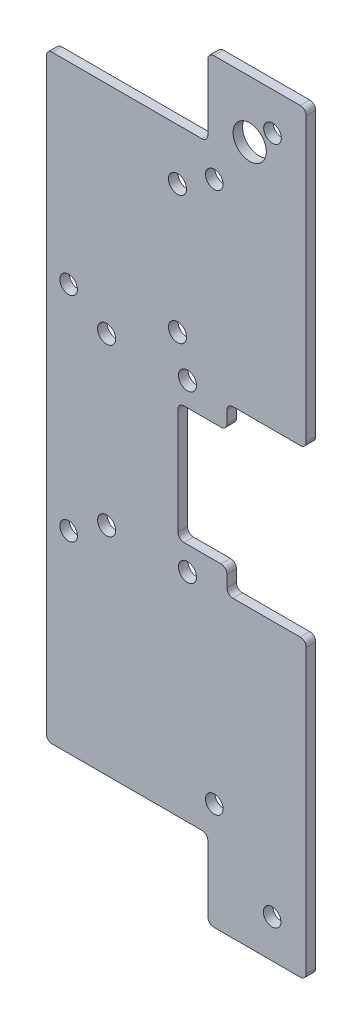
from build123d import *

# Parameters (mm, degrees)
SKETCH1_R               = 2.3495
SKETCH1_R_2             = 4.445
BOSS_EXTRUDE1_DEPTH     = 2.54
SKETCH2_R               = 2.413
CUT_EXTRUDE1_DEPTH      = 217.884748371
SKETCH3_W               = 13.08488816
SKETCH3_H               = 31.623
CUT_EXTRUDE2_DEPTH      = 217.884748371
SKETCH4_W               = 12.77569874
SKETCH4_H               = 24.435209008
SKETCH4_W_2             = 40.233428475
SKETCH4_H_2             = 28.333759116
CUT_EXTRUDE3_DEPTH      = 217.884748371
SKETCH5_R               = 2.413
CUT_EXTRUDE4_DEPTH      = 217.884748371
CUT_EXTRUDE5_DEPTH      = 217.884748371
CUT_EXTRUDE5_DEPTH_BACK = 217.884748371
SKETCH8_R               = 2.3495
CUT_EXTRUDE6_DEPTH      = 185.453324101
FILLET1_R               = 1.5875
SKETCH9_W               = 0.38488816
SKETCH9_H               = 2.54
CUT_EXTRUDE7_DEPTH      = 152.146866512


with BuildPart() as part:
    # Sketch1 → Boss-Extrude1 (new body)
    with BuildSketch(Plane.XY):
        Polygon((-2.930050059, -104.509781075), (-3.314938219, -104.509781075), (-3.314938219, -110.859781075), (-3.314938219, -123.559781075), (-2.930050059, -123.559781075), (-2.930050059, -168.708281075), (38.709428475, -168.708281075), (38.709428475, -189.536281075), (105.397061781, -189.536281075), (66.517436481, -110.859781075), (45.329949941, -110.859781075), (45.329949941, -104.509781075), (45.329949941, -72.886781075), (45.329949941, -66.536781075), (66.517436481, -66.536781075), (105.397061781, 12.139718925), (38.709428475, 12.139718925), (38.709428475, -8.688281075), (-2.930050059, -8.688281075), (-2.930050059, -53.836781075), (-3.314938219, -53.836781075), (-3.314938219, -66.536781075), (-3.314938219, -72.886781075), (-2.930050059, -72.886781075), align=None)
        with Locations((90.673911143, 2.614718925)):
            Circle(SKETCH1_R, mode=Mode.SUBTRACT)
        with Locations((41.95655448, -16.435281075)):
            Circle(SKETCH1_R, mode=Mode.SUBTRACT)
        with Locations((3.035061781, -60.186781075)):
            Circle(SKETCH1_R, mode=Mode.SUBTRACT)
        with Locations((3.035061781, -117.209781075)):
            Circle(SKETCH1_R, mode=Mode.SUBTRACT)
        with Locations((41.95655448, -160.961281075)):
            Circle(SKETCH1_R, mode=Mode.SUBTRACT)
        with Locations((90.673911143, -180.011281075)):
            Circle(SKETCH1_R, mode=Mode.SUBTRACT)
        with Locations((51.409428475, -3.100281075)):
            Circle(SKETCH1_R_2, mode=Mode.SUBTRACT)
    extrude(amount=BOSS_EXTRUDE1_DEPTH)

    # Sketch2 → Cut-Extrude1 (cut, through all)
    with BuildSketch(Plane.XY.offset(2.54)):
        with Locations((13.195061781, -66.536781075)):
            Circle(SKETCH2_R)
        with Locations((34.785061781, -66.536781075)):
            Circle(SKETCH2_R)
        with Locations((34.785061781, -110.859781075)):
            Circle(SKETCH2_R)
        with Locations((13.195061781, -110.859781075)):
            Circle(SKETCH2_R)
    extrude(amount=-CUT_EXTRUDE1_DEPTH, mode=Mode.SUBTRACT)

    # Sketch3 → Cut-Extrude2 (cut, through all)
    with BuildSketch(Plane.XY.offset(2.54)):
        with Locations((38.787505861, -88.698281075)):
            Rectangle(SKETCH3_W, SKETCH3_H)
    extrude(amount=-CUT_EXTRUDE2_DEPTH, mode=Mode.SUBTRACT)

    # Sketch4 → Cut-Extrude3 (cut, through all)
    with BuildSketch(Plane.XY.offset(2.54)):
        with Locations((33.845579105, 3.529323429)):
            Rectangle(SKETCH4_W, SKETCH4_H)
        with Locations((20.116714238, -182.875160633)):
            Rectangle(SKETCH4_W_2, SKETCH4_H_2)
    extrude(amount=-CUT_EXTRUDE3_DEPTH, mode=Mode.SUBTRACT)

    # Sketch5 → Cut-Extrude4 (cut, through all)
    with BuildSketch(Plane(origin=(0, 0, 0), x_dir=(-1, 0, 0), z_dir=(0, 0, -1))):
        with Locations((-32.121949941, -22.404281075)):
            Circle(SKETCH5_R)
        with Locations((-32.121949941, -56.694281075)):
            Circle(SKETCH5_R)
    extrude(amount=-CUT_EXTRUDE4_DEPTH, mode=Mode.SUBTRACT)

    # Sketch7 → Cut-Extrude5 (cut, two sides: drawn at the far end of the back side and taken through both)
    with BuildSketch(Plane.XY.offset(2.54).offset(-CUT_EXTRUDE5_DEPTH_BACK)):
        Polygon((66.517436481, -66.536781075), (66.517436481, 21.52212206), (127.820808625, 21.52212206), (115.78217236, -200.256310461), (66.517436481, -200.256310461), (66.517436481, -110.859781075), align=None)
    extrude(amount=CUT_EXTRUDE5_DEPTH + CUT_EXTRUDE5_DEPTH_BACK, mode=Mode.SUBTRACT)

    # Sketch8 → Cut-Extrude6 (cut, through all)
    with BuildSketch(Plane(origin=(13.551580143, -164.527185826, 0), x_dir=(0.9999106684671756, -0.013366191885727564, 0), z_dir=(0, 0, -1))):
        with Locations((41.721218349, -167.120322092)):
            Circle(SKETCH8_R)
        with Locations((44.049502294, 14.21950649)):
            Circle(SKETCH8_R)
    extrude(amount=-CUT_EXTRUDE6_DEPTH, mode=Mode.SUBTRACT)

    # Fillet1
    fillet1_edges = [part.edges().sort_by_distance(p)[0] for p in [
        (-2.930050059, -168.708281075, 1.27),
        (40.233428475, -168.708281075, 1.27),
        (40.233428475, -189.536281075, 1.27),
        (66.517436481, -189.536281075, 1.27),
        (66.517436481, -110.859781075, 1.27),
        (45.329949941, -110.859781075, 1.27),
        (45.329949941, -104.509781075, 1.27),
        (32.245061781, -104.509781075, 1.27),
        (32.245061781, -72.886781075, 1.27),
        (45.329949941, -72.886781075, 1.27),
        (45.329949941, -66.536781075, 1.27),
        (66.517436481, -66.536781075, 1.27),
        (66.517436481, 12.139718925, 1.27),
        (40.233428475, 12.139718925, 1.27),
        (40.233428475, -8.688281075, 1.27),
        (-2.930050059, -8.688281075, 1.27),
    ]]
    fillet(fillet1_edges, radius=FILLET1_R)

    # Sketch9 → Cut-Extrude7 (cut, through all)
    with BuildSketch(Plane.XZ.offset(123.559781075)):
        with Locations((-3.122494139, 1.27)):
            Rectangle(SKETCH9_W, SKETCH9_H)
    extrude(amount=-CUT_EXTRUDE7_DEPTH, mode=Mode.SUBTRACT)


solid = part.part
